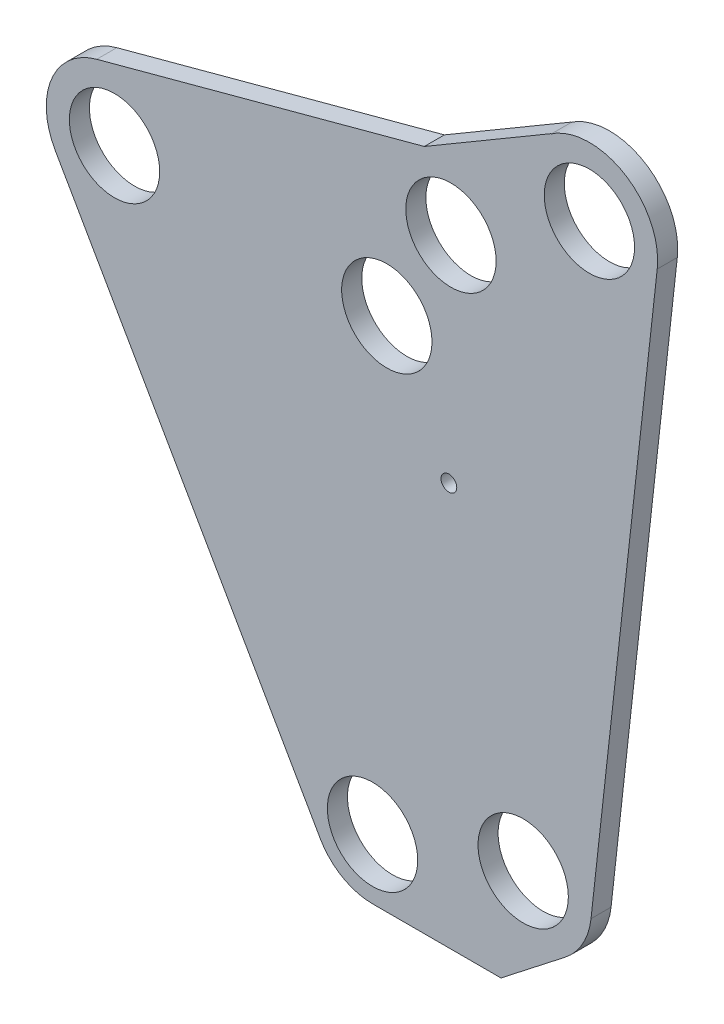
from build123d import *

# Parameters (mm, degrees)
SKETCH38_S_25_GCI_S_0001_2_R   = 14.2875
SKETCH38_S_25_GCI_S_0001_2_R_2 = 2.4892
BOSS_EXTRUDE1_DEPTH            = 6.35


with BuildPart() as part:
    # Sketch38-S-25-GCI-S-0001<2> → Boss-Extrude1 (new body)
    with BuildSketch(Plane.XY):
        with BuildLine():
            Line((-264.018970309, 170.472247709), (-180.180840514, 23.859477146))
            ThreePointArc((-180.180840514, 23.859477146), (-173.20288569, 16.837977487), (-163.643695766, 14.265974574))
            Line((-163.643695766, 14.265974574), (-123.003695766, 14.265974574))
            Line((-123.003695766, 14.265974574), (-102.701690709, 30.111347625))
            ThreePointArc((-102.701690709, 30.111347625), (-97.136259348, 36.603052533), (-94.527470618, 44.746177253))
            Line((-94.527470618, 44.746177253), (-73.579456224, 233.219900156))
            ThreePointArc((-73.579456224, 233.219900156), (-84.21325942, 254.285523968), (-107.777529583, 253.03514457))
            Line((-107.777529583, 253.03514457), (-106.905210069, 253.672742915))
            Line((-106.905210069, 253.672742915), (-147.265123416, 229.961669682))
            Line((-147.265123416, 229.961669682), (-250.894481162, 202.035967923))
            ThreePointArc((-250.894481162, 202.035967923), (-265.212166326, 189.478892321), (-264.018970309, 170.472247709))
        make_face()
        with Locations((-159.123738045, 177.622002267)):
            Circle(SKETCH38_S_25_GCI_S_0001_2_R, mode=Mode.SUBTRACT)
        with Locations((-138.837829347, 209.872458207)):
            Circle(SKETCH38_S_25_GCI_S_0001_2_R, mode=Mode.SUBTRACT)
        with Locations((-245.276872929, 181.189611461)):
            Circle(SKETCH38_S_25_GCI_S_0001_2_R, mode=Mode.SUBTRACT)
        with Locations((-95.03732495, 235.604846641)):
            Circle(SKETCH38_S_25_GCI_S_0001_2_R, mode=Mode.SUBTRACT)
        with Locations((-115.985339344, 47.131123738)):
            Circle(SKETCH38_S_25_GCI_S_0001_2_R, mode=Mode.SUBTRACT)
        with Locations((-163.643695766, 33.315974574)):
            Circle(SKETCH38_S_25_GCI_S_0001_2_R, mode=Mode.SUBTRACT)
        with Locations((-139.48732495, 141.624846641)):
            Circle(SKETCH38_S_25_GCI_S_0001_2_R_2, mode=Mode.SUBTRACT)
    extrude(amount=BOSS_EXTRUDE1_DEPTH)


solid = part.part
